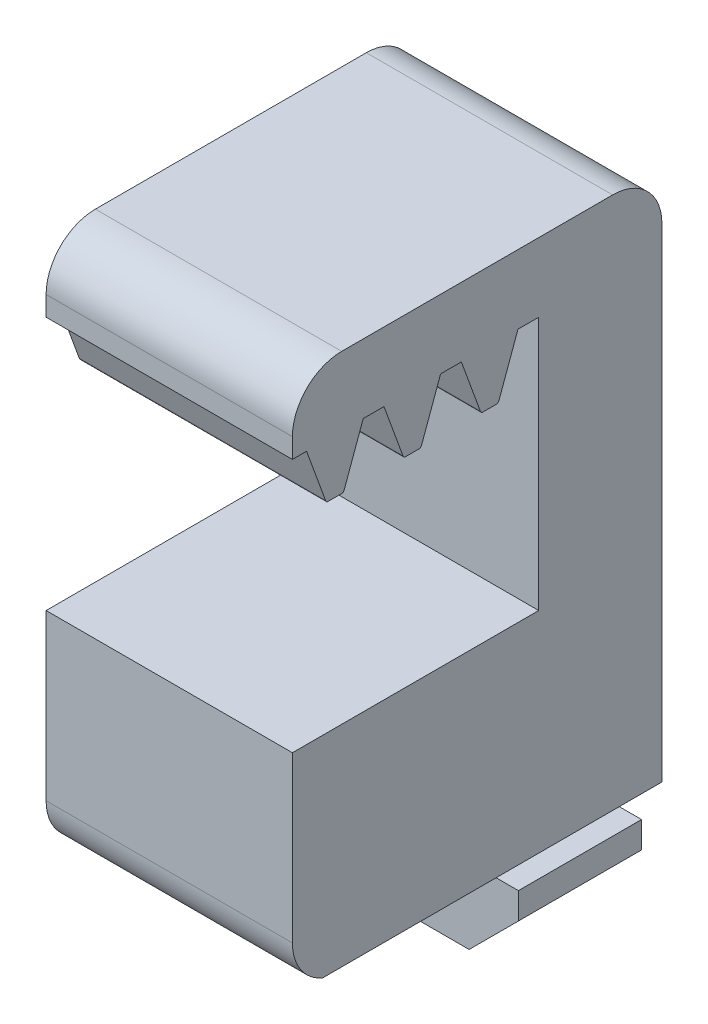
from build123d import *

# Parameters (mm, degrees)
BOSS_EXTRUDE1_DEPTH = 6.35
CUT_EXTRUDE1_DEPTH  = 36.926412234
LPATTERN1_COUNT     = 10
LPATTERN1_PITCH     = 3.989832
CUT_EXTRUDE2_DEPTH  = 35.201456051
FILLET1_R           = 2.54
CUT_EXTRUDE3_DEPTH  = 35.201456051
SKETCH6_W           = 12.7
SKETCH6_H           = 0.396875
CUT_EXTRUDE4_DEPTH  = 36.926412234


with BuildPart() as part:
    # Sketch1 → Boss-Extrude1 (new, symmetric)
    with BuildSketch(Plane(origin=(0, 0, 0), x_dir=(0, 0, -1), z_dir=(1, 0, 0))):
        Polygon((12.7, 0), (12.7, -6.096), (19.05, -6.096), (19.05, 27.686), (12.7, 27.686), (0, 27.686), (0, 21.336), (12.7, 21.336), (12.7, 11.43), (0, 11.43), (0, 0), align=None)
    extrude(amount=BOSS_EXTRUDE1_DEPTH, both=True)

    # Sketch2 → Cut-Extrude1 (cut, through all)
    with BuildSketch(Plane(origin=(6.35, 0, 0), x_dir=(0, 0, -1), z_dir=(1, 0, 0))):
        with BuildLine():
            Line((3.649904395, 24.13), (4.720336, 24.13))
            Line((4.720336, 24.13), (5.694793618, 21.452699698))
            ThreePointArc((5.694793618, 21.452699698), (5.787994572, 21.33123785), (5.934007978, 21.2852))
            Line((5.934007978, 21.2852), (6.426064417, 21.2852))
            ThreePointArc((6.426064417, 21.2852), (6.572077823, 21.33123785), (6.665278777, 21.452699698))
            Line((6.665278777, 21.452699698), (7.639736395, 24.13))
            Line((7.639736395, 24.13), (8.710168, 24.13))
            Line((8.710168, 24.13), (9.684625618, 21.452699698))
            ThreePointArc((9.684625618, 21.452699698), (9.777826572, 21.33123785), (9.923839978, 21.2852))
            Line((9.923839978, 21.2852), (10.415896417, 21.2852))
            ThreePointArc((10.415896417, 21.2852), (10.561909823, 21.33123785), (10.655110777, 21.452699698))
            Line((10.655110777, 21.452699698), (11.629568395, 24.13))
            Line((11.629568395, 24.13), (12.7, 24.13))
            Line((12.7, 24.13), (12.7, 11.43))
            Line((12.7, 11.43), (3.649904395, 11.43))
            Line((3.649904395, 11.43), (3.649904395, 24.13))
        make_face()
    cut_extrude1 = extrude(amount=-CUT_EXTRUDE1_DEPTH, mode=Mode.SUBTRACT)

    # LPattern1: Cut-Extrude1 ×10
    with Locations(*[(0, 0, i * LPATTERN1_PITCH) for i in range(1, LPATTERN1_COUNT)]):
        add(cut_extrude1, mode=Mode.SUBTRACT)

    # Sketch3 → Cut-Extrude2 (cut, through all)
    with BuildSketch(Plane(origin=(0, 0, -19.05), x_dir=(-1, 0, 0), z_dir=(0, 0, -1))):
        Polygon((-6.35, -6.096), (-2.839339828, -6.1), (-5.5, -3.439339828), (-5.5, -1.8), (-3.125, -1.8), (-3.125, -1.455), (-4.58, 0), (-9.5, 0), align=None)
        Polygon((2.839339828, -6.1), (6.35, -6.096), (15.42, 0), (4.58, 0), (3.125, -1.455), (3.125, -1.8), (5.5, -1.8), (5.5, -3.439339828), align=None)
    extrude(amount=-CUT_EXTRUDE2_DEPTH, mode=Mode.SUBTRACT)

    # Fillet1
    fillet1_edges = [part.edges().sort_by_distance(p)[0] for p in [
        (0, 0, 0),
        (0, 27.686, 0),
        (0, 27.686, -19.05),
    ]]
    fillet(fillet1_edges, radius=FILLET1_R)

    # Sketch5 → Cut-Extrude3 (cut, through all)
    with BuildSketch(Plane(origin=(0, 0, -19.05), x_dir=(-1, 0, 0), z_dir=(0, 0, -1))):
        Polygon((6.35, 0), (4.58, 0), (3.125, -1.455), (3.125, -1.8), (5.5, -1.8), (5.5, -3.439339828), (2.843339828, -6.096), (-2.843339828, -6.096), (-5.5, -3.439339828), (-5.5, -1.8), (-3.125, -1.8), (-3.125, -1.455), (-4.58, 0), (-6.35, 0), (-6.35, 0.1984375), (-4.497804496, 0.1984375), (-2.9265625, -1.372804496), (-2.9265625, -1.9984375), (-5.3015625, -1.9984375), (-5.3015625, -3.357144324), (-2.761144324, -5.8975625), (2.761144324, -5.8975625), (5.3015625, -3.357144324), (5.3015625, -1.9984375), (2.9265625, -1.9984375), (2.9265625, -1.372804496), (4.497804496, 0.1984375), (6.35, 0.1984375), align=None)
    extrude(amount=-CUT_EXTRUDE3_DEPTH, mode=Mode.SUBTRACT)

    # Sketch6 → Cut-Extrude4 (cut, through all)
    with BuildSketch(Plane(origin=(6.35, 0, 0), x_dir=(0, 0, -1), z_dir=(1, 0, 0))):
        with Locations((6.35, 11.2315625)):
            Rectangle(SKETCH6_W, SKETCH6_H)
    extrude(amount=-CUT_EXTRUDE4_DEPTH, mode=Mode.SUBTRACT)


solid = part.part
